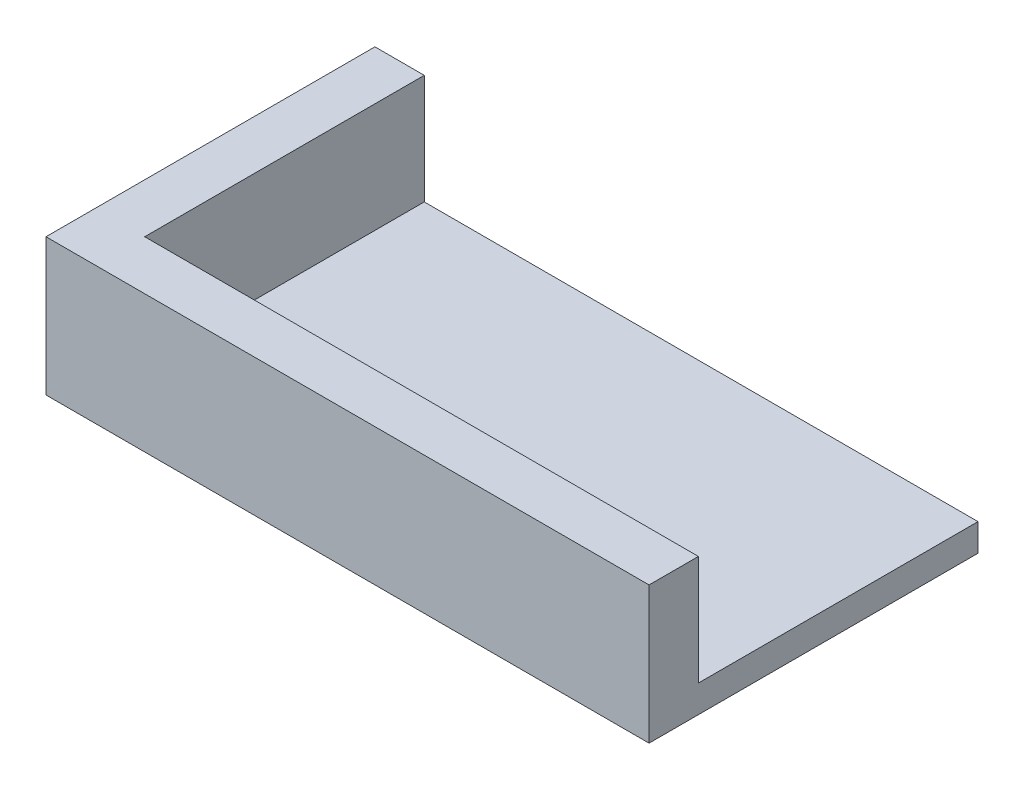
from build123d import *

# Parameters (mm, degrees)
SKETCH1_W           = 139.7
SKETCH1_H           = 76.2
BOSS_EXTRUDE1_DEPTH = 31.75
SKETCH2_W           = 128.27
SKETCH2_H           = 64.815947231
CUT_EXTRUDE1_DEPTH  = 25.4
SKETCH3_W           = 10.16
SKETCH3_H           = 10.16
BOSS_EXTRUDE3_DEPTH = 12.7
SKETCH4_R           = 2.032
CUT_EXTRUDE2_DEPTH  = 82.814026915
SKETCH5_R           = 3.937
CUT_EXTRUDE3_DEPTH  = 2.286


with BuildPart() as part:
    # Sketch1 → Boss-Extrude1 (new body)
    with BuildSketch(Plane(origin=(0, 0, 0), x_dir=(1, 0, 0), z_dir=(0, 1, 0))):
        Rectangle(SKETCH1_W, SKETCH1_H)
    extrude(amount=BOSS_EXTRUDE1_DEPTH)

    # Sketch2 → Cut-Extrude1 (cut)
    with BuildSketch(Plane(origin=(0, 31.75, 0), x_dir=(1, 0, 0), z_dir=(0, 1, 0))):
        with Locations((5.715, 5.737973615)):
            Rectangle(SKETCH2_W, SKETCH2_H)
    extrude(amount=-CUT_EXTRUDE1_DEPTH, mode=Mode.SUBTRACT)

    # Sketch3 → Boss-Extrude3 (add)
    with BuildSketch(Plane(origin=(0, 6.35, 0), x_dir=(1, 0, 0), z_dir=(0, 1, 0))):
        with Locations((-53.34, -21.59)):
            Rectangle(SKETCH3_W, SKETCH3_H)
    extrude(amount=BOSS_EXTRUDE3_DEPTH)

    # Sketch4 → Cut-Extrude2 (cut, through all)
    with BuildSketch(Plane(origin=(0, 19.05, 0), x_dir=(1, 0, 0), z_dir=(0, 1, 0))):
        with Locations((-53.34, -21.59)):
            Circle(SKETCH4_R)
    extrude(amount=-CUT_EXTRUDE2_DEPTH, mode=Mode.SUBTRACT)

    # Sketch5 → Cut-Extrude3 (cut)
    with BuildSketch(Plane(origin=(0, 19.05, 0), x_dir=(1, 0, 0), z_dir=(0, 1, 0))):
        with Locations((-53.34, -21.59)):
            Circle(SKETCH5_R)
    extrude(amount=-CUT_EXTRUDE3_DEPTH, mode=Mode.SUBTRACT)


solid = part.part
